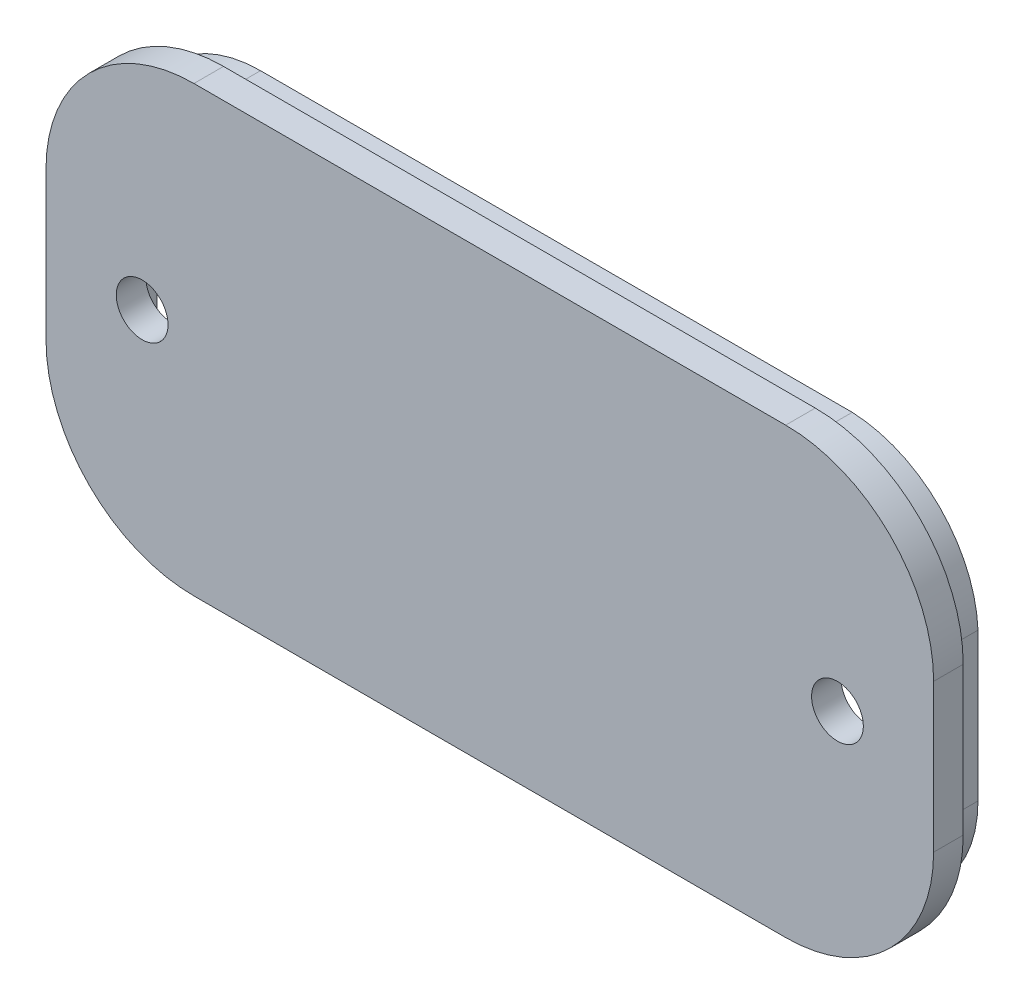
from build123d import *

# Parameters (mm, degrees)
SKETCH_9_R      = 1.75
EXTRUDE_3_DEPTH = 2
EXTRUDE_START   = -2.5
EXTRUDE_4_DEPTH = 2.5


# Read off the part's stored shape, not the designer's step: Бобышка-Вытянуть4
with BuildPart() as part:
    # Эскиз9 → Бобышка-Вытянуть3 (new body)
    with BuildSketch(Plane.XY):
        with BuildLine():
            Line((-30, 8), (-30, -2))
            ThreePointArc((-30, -2), (-27.071067812, -9.071067812), (-20, -12))
            Line((-20, -12), (20, -12))
            ThreePointArc((20, -12), (27.071067812, -9.071067812), (30, -2))
            Line((30, -2), (30, 8))
            ThreePointArc((30, 8), (27.071067812, 15.071067812), (20, 18))
            Line((20, 18), (-20, 18))
            ThreePointArc((-20, 18), (-27.071067812, 15.071067812), (-30, 8))
        make_face()
        with Locations((23.5, 3)):
            Circle(SKETCH_9_R, mode=Mode.SUBTRACT)
        with Locations((-23.5, 3)):
            Circle(SKETCH_9_R, mode=Mode.SUBTRACT)
    extrude(amount=EXTRUDE_3_DEPTH)

    # Бобышка-Вытянуть4 outline → Бобышка-Вытянуть4 (add)
    with BuildSketch(Plane.XY.offset(EXTRUDE_START)):
        with BuildLine():
            Line((20, 16.5), (-20, 16.5))
            ThreePointArc((-20, 16.5), (-26.01040764, 14.01040764), (-28.5, 8))
            Line((-28.5, 8), (-28.5, -2))
            ThreePointArc((-28.5, -2), (-26.01040764, -8.01040764), (-20, -10.5))
            Line((-20, -10.5), (20, -10.5))
            ThreePointArc((20, -10.5), (26.01040764, -8.01040764), (28.5, -2))
            Line((28.5, -2), (28.5, 8))
            ThreePointArc((28.5, 8), (25.905867423, 13.905867423), (20, 16.5))
        make_face()
        with BuildLine():
            ThreePointArc((-19.623843683, -9.007966855), (-24.845207251, -6.845207251), (-27.007966855, -1.623843683))
            Line((-27.007966855, -1.623843683), (-27.007966855, 7.623843683))
            ThreePointArc((-27.007966855, 7.623843683), (-24.845207251, 12.845207251), (-19.623843683, 15.007966855))
            Line((-19.623843683, 15.007966855), (0, 15))
            Line((0, 15), (19.623843683, 15.007966855))
            ThreePointArc((19.623843683, 15.007966855), (24.845207251, 12.845207251), (27.007966855, 7.623843683))
            Line((27.007966855, 7.623843683), (27.007966855, -1.623843683))
            ThreePointArc((27.007966855, -1.623843683), (24.845207251, -6.845207251), (19.623843683, -9.007966855))
            Line((19.623843683, -9.007966855), (-19.623843683, -9.007966855))
        make_face(mode=Mode.SUBTRACT)
    extrude(amount=EXTRUDE_4_DEPTH)


solid = part.part
